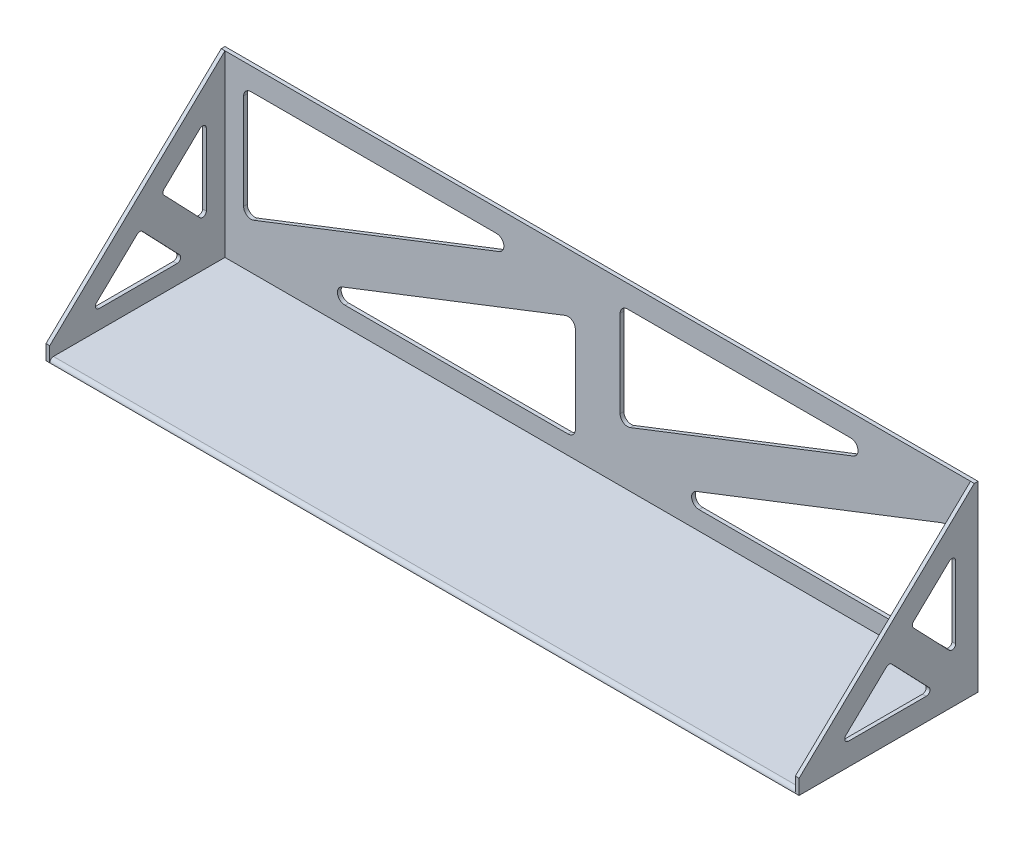
from build123d import *

# Parameters (mm, degrees)
SKETCH1_W           = 1270
SKETCH1_H           = 6.35
BOSS_EXTRUDE1_DEPTH = 152.4
SKETCH2_W           = 1270
SKETCH2_H           = 6.35
BOSS_EXTRUDE2_DEPTH = 304.8
BOSS_EXTRUDE3_DEPTH = 6.35
CUT_EXTRUDE1_DEPTH  = 1328.92833038
FILLET1_R           = 6.35
FILLET2_R           = 6.35
CUT_EXTRUDE2_DEPTH  = 775.003529142
FILLET3_R           = 12.7
FILLET4_R           = 6.35


with BuildPart() as part:
    # Sketch1 → Boss-Extrude1 (new, symmetric)
    with BuildSketch(Plane.XY):
        Rectangle(SKETCH1_W, SKETCH1_H)
    extrude(amount=BOSS_EXTRUDE1_DEPTH, both=True)

    # Sketch2 → Boss-Extrude2 (add)
    with BuildSketch(Plane(origin=(0, 3.175, 0), x_dir=(1, 0, 0), z_dir=(0, 1, 0))):
        with Locations((0, 149.225)):
            Rectangle(SKETCH2_W, SKETCH2_H)
    extrude(amount=BOSS_EXTRUDE2_DEPTH)

    # Sketch3 → Boss-Extrude3 (add)
    with BuildSketch(Plane(origin=(635, 0, 0), x_dir=(0, 0, -1), z_dir=(1, 0, 0))):
        Polygon((152.4, -3.175), (-152.4, -3.175), (-152.4, 22.225), (146.05, 307.975), (152.4, 307.975), align=None)
    boss_extrude3 = extrude(amount=BOSS_EXTRUDE3_DEPTH)

    # Mirror1: Boss-Extrude3 across plane
    add(boss_extrude3.mirror(Plane(origin=(0, 0, 0), x_dir=(0, 0, 1), z_dir=(1, 0, 0))))

    # Sketch4 → Cut-Extrude1 (cut, through all)
    with BuildSketch(Plane(origin=(641.35, 0, 0), x_dir=(0, 0, -1), z_dir=(1, 0, 0))):
        Polygon((-84.04363802, 34.925), (79.134946254, 34.925), (1.09133899, 116.437212031), align=None)
        Polygon((37.784585908, 151.569044186), (114.3, 71.652945024), (114.3, 224.82848321), align=None)
    extrude(amount=-CUT_EXTRUDE1_DEPTH, mode=Mode.SUBTRACT)

    # Fillet1
    fillet1_edges = [part.edges().sort_by_distance(p)[0] for p in [
        (638.175, 34.925, -79.134946254),
        (638.175, 34.925, 84.04363802),
        (638.175, 116.437212031, -1.09133899),
        (638.175, 71.652945024, -114.3),
        (638.175, 151.569044186, -37.784585908),
        (638.175, 224.82848321, -114.3),
    ]]
    fillet(fillet1_edges, radius=FILLET1_R)

    # Fillet2
    fillet2_edges = [part.edges().sort_by_distance(p)[0] for p in [
        (-638.175, 34.925, -79.134946254),
        (-638.175, 34.925, 84.04363802),
        (-638.175, 116.437212031, -1.09133899),
        (-638.175, 71.652945024, -114.3),
        (-638.175, 151.569044186, -37.784585908),
        (-638.175, 224.82848321, -114.3),
    ]]
    fillet(fillet2_edges, radius=FILLET2_R)

    # Sketch5 → Cut-Extrude2 (cut, through all)
    with BuildSketch(Plane(origin=(0, 0, -152.4), x_dir=(-1, 0, 0), z_dir=(0, 0, -1))):
        Polygon((-38.1, 269.875), (-498.26805665, 269.875), (-38.1, 90.65165162), align=None)
        Polygon((-104.98194335, 34.925), (-603.25, 228.987295748), (-603.25, 34.925), align=None)
        Polygon((38.1, 214.14834838), (38.1, 34.925), (498.26805665, 34.925), align=None)
        Polygon((603.25, 269.875), (104.98194335, 269.875), (603.25, 75.812704252), align=None)
    extrude(amount=-CUT_EXTRUDE2_DEPTH, mode=Mode.SUBTRACT)

    # Fillet3
    fillet3_edges = [part.edges().sort_by_distance(p)[0] for p in [
        (38.1, 90.65165162, -149.225),
        (498.26805665, 269.875, -149.225),
        (38.1, 269.875, -149.225),
        (603.25, 34.925, -149.225),
        (603.25, 228.987295748, -149.225),
        (104.98194335, 34.925, -149.225),
        (-38.1, 214.14834838, -149.225),
        (-498.26805665, 34.925, -149.225),
        (-38.1, 34.925, -149.225),
        (-104.98194335, 269.875, -149.225),
        (-603.25, 269.875, -149.225),
        (-603.25, 75.812704252, -149.225),
    ]]
    fillet(fillet3_edges, radius=FILLET3_R)

    # Fillet4
    fillet4_edges = [part.edges().sort_by_distance(p)[0] for p in [
        (0, 3.175, 152.4),
    ]]
    fillet(fillet4_edges, radius=FILLET4_R - 0.0001)  # a hair under: the kernel refuses the full size


solid = part.part
